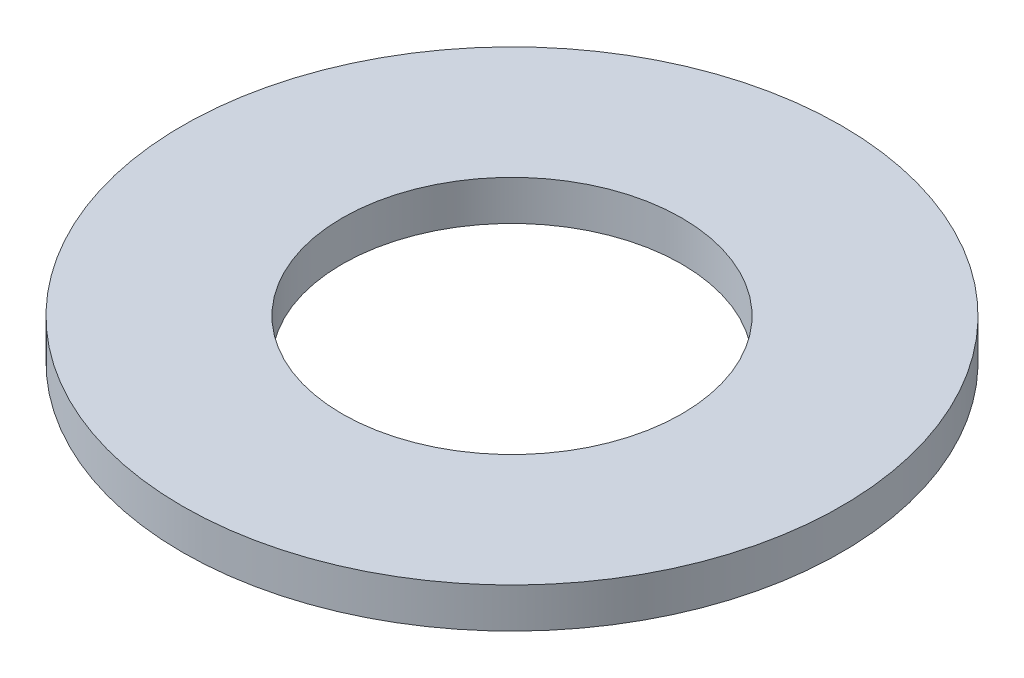
from build123d import *

# Parameters (mm, degrees)
SKETCH1_R           = 82.5
BOSS_EXTRUDE1_DEPTH = 10
SKETCH2_R           = 42.5
CUT_EXTRUDE1_DEPTH  = 118.100384286


with BuildPart() as part:
    # Sketch1 → Boss-Extrude1 (new body)
    with BuildSketch(Plane(origin=(0, 0, 0), x_dir=(1, 0, 0), z_dir=(0, 1, 0))):
        Circle(SKETCH1_R)
    extrude(amount=BOSS_EXTRUDE1_DEPTH)

    # Sketch2 → Cut-Extrude1 (cut, through all)
    with BuildSketch(Plane(origin=(0, 0, 0), x_dir=(1, 0, 0), z_dir=(0, 1, 0))):
        Circle(SKETCH2_R)
    extrude(amount=CUT_EXTRUDE1_DEPTH, mode=Mode.SUBTRACT)


solid = part.part
